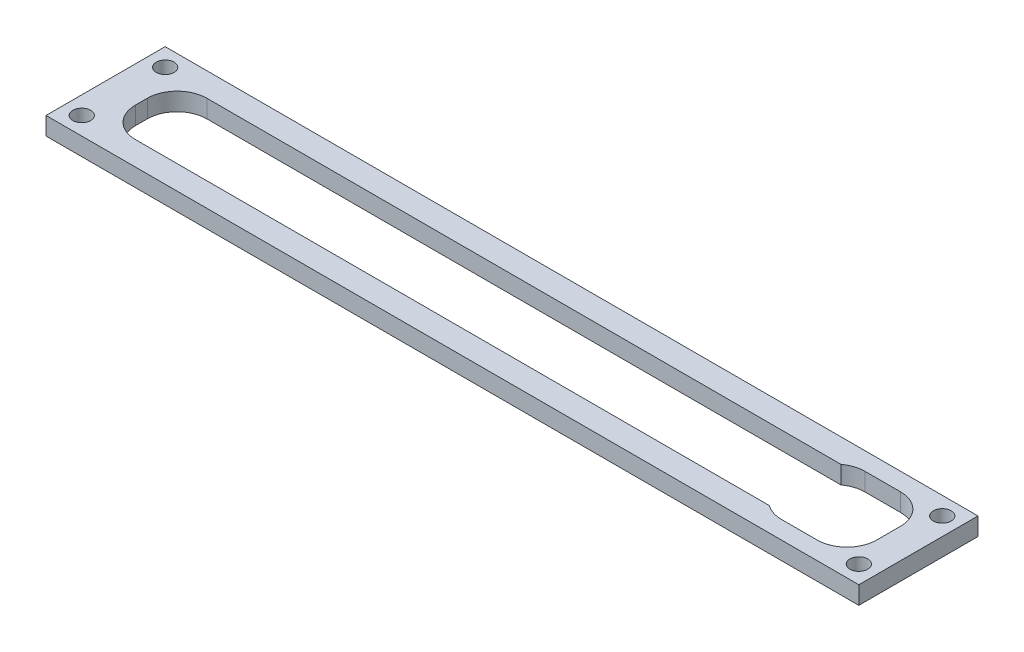
from build123d import *

# Parameters (mm, degrees)
SKETCH1_W           = 136.427821805
SKETCH1_H           = 20
SKETCH1_R           = 1.5
SKETCH1_W_2         = 124.427821805
SKETCH1_H_2         = 12
BOSS_EXTRUDE1_DEPTH = 3
CUT_EXTRUDE1_DEPTH  = 138.918637473
FILLET1_R           = 5


with BuildPart() as part:
    # Sketch1 → Boss-Extrude1 (new body)
    with BuildSketch(Plane(origin=(0, 0, 0), x_dir=(1, 0, 0), z_dir=(0, 1, 0))):
        with Locations((68.213910903, 10)):
            Rectangle(SKETCH1_W, SKETCH1_H)
        with Locations(Location((3, 17, 0), (0, 0, 270))):
            Circle(SKETCH1_R, mode=Mode.SUBTRACT)
        with Locations(Location((3, 3, 0), (0, 0, 90))):
            Circle(SKETCH1_R, mode=Mode.SUBTRACT)
        with Locations(Location((133.427821805, 3, 0), (0, 0, 270))):
            Circle(SKETCH1_R, mode=Mode.SUBTRACT)
        with Locations(Location((133.427821805, 17, 0), (0, 0, 90))):
            Circle(SKETCH1_R, mode=Mode.SUBTRACT)
        with Locations((68.213910903, 10)):
            Rectangle(SKETCH1_W_2, SKETCH1_H_2, mode=Mode.SUBTRACT)
    extrude(amount=BOSS_EXTRUDE1_DEPTH)

    # Sketch2 → Cut-Extrude1 (cut, through all)
    with BuildSketch(Plane(origin=(0, 3, 0), x_dir=(1, 0, 0), z_dir=(0, 1, 0))):
        Polygon((117.427821805, 17), (117.427821805, 16), (130.427821805, 16), (130.427821805, 4), (117.427821805, 4), (117.427821805, 3), (131.427821805, 3), (131.427821805, 17), align=None)
    extrude(amount=-CUT_EXTRUDE1_DEPTH, mode=Mode.SUBTRACT)

    # Fillet1
    # the kernel refuses this fillet: 5 mm, written as the material it adds along each edge
    with BuildSketch(Plane(origin=(131.427821805, 3, -17), x_dir=(0, 0, 1), z_dir=(0, -1, 0)), Plane(origin=(131.427821805, 3, -3), x_dir=(-1, 0, 0), z_dir=(0, -1, 0)), Plane(origin=(6, 0, -16), x_dir=(0, 0, 1), z_dir=(0, 1, 0))) as fillet1_piece_1:
        with BuildLine():
            CenterArc((FILLET1_R, FILLET1_R), FILLET1_R, 180, 90)
            Line((0, FILLET1_R), (-FILLET1_R * 0.02, FILLET1_R))
            Line((-FILLET1_R * 0.02, FILLET1_R), (-FILLET1_R * 0.02, -FILLET1_R * 0.02))
            Line((-FILLET1_R * 0.02, -FILLET1_R * 0.02), (FILLET1_R, -FILLET1_R * 0.02))
            Line((FILLET1_R, -FILLET1_R * 0.02), (FILLET1_R, 0))
        make_face()
    extrude(amount=3)
    with BuildSketch(Plane(origin=(117.427821805, 3, -17), x_dir=(1, 0, 0), z_dir=(0, -1, 0))) as fillet1_piece_2:
        with BuildLine():
            CenterArc((3, 5), FILLET1_R, 233.130102354, 36.869897646)
            Line((0, 1), (-0.06, 0.92))
            ThreePointArc((-0.06, 0.92), (-0.1, 0.5), (-0.1, 0))
            Line((-0.1, 0), (0, -0.1))
            Line((0, -0.1), (3, -0.1))
            Line((3, -0.1), (3, 0))
        make_face()
    extrude(amount=3)
    with BuildSketch(Plane(origin=(117.427821805, 3, -3), x_dir=(0, 0, -1), z_dir=(0, -1, 0))) as fillet1_piece_3:
        with BuildLine():
            CenterArc((5, 3), FILLET1_R, 180, 36.869897646)
            Line((0, 3), (-0.1, 3))
            Line((-0.1, 3), (-0.1, 0))
            Line((-0.1, 0), (0, -0.1))
            ThreePointArc((0, -0.1), (0.5, -0.1), (0.92, -0.06))
            Line((0.92, -0.06), (1, 0))
        make_face()
    extrude(amount=3)
    with BuildSketch(Plane(origin=(6, 0, -4), x_dir=(0, 0, -1), z_dir=(0, 1, 0))) as fillet1_piece_4:
        with BuildLine():
            CenterArc((FILLET1_R, -FILLET1_R), FILLET1_R, 90, 90)
            Line((0, -FILLET1_R), (-FILLET1_R * 0.02, -FILLET1_R))
            Line((-FILLET1_R * 0.02, -FILLET1_R), (-FILLET1_R * 0.02, FILLET1_R * 0.02))
            Line((-FILLET1_R * 0.02, FILLET1_R * 0.02), (FILLET1_R, FILLET1_R * 0.02))
            Line((FILLET1_R, FILLET1_R * 0.02), (FILLET1_R, 0))
        make_face()
    extrude(amount=3)


solid = part.part
